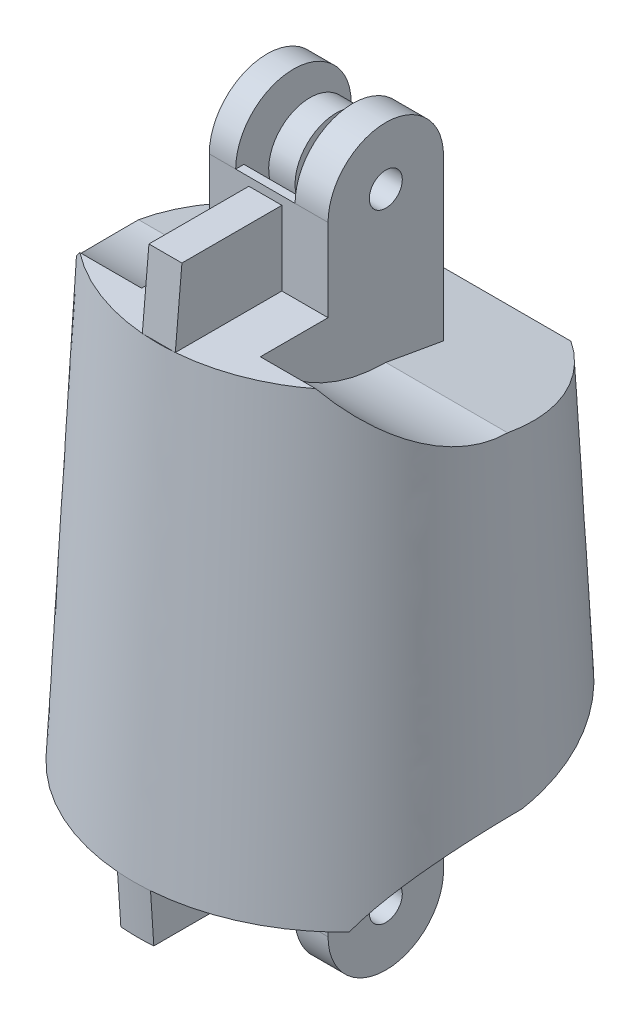
from build123d import *

# Parameters (mm, degrees)
SKETCH1_RX                      = 11
SKETCH1_RY                      = 10
SKETCH2_RX                      = 12.25
SKETCH2_RY                      = 11.5
HINGE_START                     = 1.8
SKETCH6_R                       = 1
HINGE_RIGHT_DEPTH               = 2
SPRING_SEAT_REACH               = 34.227
SPRING_SEAT_DIRECTION_2_REACH   = 34.227
ROUNDED_START                   = 3.8
SKETCH8_R                       = 9.1
ROUNDED_CUT_1_DEPTH             = 29.426735954
ROUNDED_START_2                 = -3.4
SKETCH8_2_R                     = 9.1
ROUNDED_CUT_2_DEPTH             = 29.826735954
BETWEEN_ROUNDED_CUTS_DEPTH      = 33.226735954
SKETCH13_R                      = 2.5
SPRING_DEPTH                    = 0.8
BOTTOM_START                    = -12.115064089
BOTTOM_HINGE_MIRROR_DEPTH       = 24.365064089
BOTTOM_START_2                  = -13
BOTTOM_HINGE_MIRROR_2_DEPTH     = 9.6
BOTTOM_START_3                  = 3.8
BOTTOM_HINGE_MIRROR_3_DEPTH     = 9.2
BOTTOM_START_4                  = -3.4
BOTTOM_HINGE_MIRROR_4_DEPTH     = 7.2
BOTTOM_START_5                  = 1.8
BOTTOM_HINGE_MIRROR_5_OUTLINE_R = 1
BOTTOM_HINGE_MIRROR_5_DEPTH     = 2
BOTTOM_HINGE_MIRROR_6_OUTLINE_R = 1
BOTTOM_HINGE_MIRROR_6_DEPTH     = 1.6
CUT_EXTRUDE1_DEPTH              = 40.670912859
CUT_EXTRUDE1_DEPTH_BACK         = 40.670912859
SKETCH11_W                      = 16.412618891
SKETCH11_H                      = 3
SKETCH12_R                      = 1.1
CORD_HOLE_DEPTH                 = 40.670912859
SPRING_SLOT_1_DEPTH             = 11
SPRING_SLOT_2_2_DEPTH           = 11
BOSS_EXTRUDE1_DEPTH             = 4.5
CUT_EXTRUDE2_DEPTH              = 40.986355172
CUT_EXTRUDE2_DEPTH_BACK         = 40.986355172
BOSS_EXTRUDE2_DEPTH             = 3
CHAMFER1_SIZE                   = 0.2
SKETCH19_W                      = 2
SKETCH19_H                      = 4.5
BOSS_EXTRUDE3_DEPTH             = 1.458591955
BOSS_EXTRUDE4_REACH             = 42.173
SKETCH20_W                      = 2
SKETCH20_H                      = 3


with BuildPart() as part:
    # Sketch1 → Loft2 section 0
    with BuildSketch(Plane(origin=(0, 0, 0), x_dir=(1, 0, 0), z_dir=(0, 1, 0))):
        with Locations(Location((0, 0), (0, 0, 0))):
            Ellipse(SKETCH1_RX, SKETCH1_RY)
    # Sketch2 → Loft2 section 1
    with BuildSketch(Plane(origin=(0, -27.5, 0), x_dir=(1, 0, 0), z_dir=(0, 1, 0))):
        with Locations((0, 0)):
            Ellipse(SKETCH2_RX, SKETCH2_RY)
    loft()

    # Sketch6 → hinge right (add)
    with BuildSketch(Plane(origin=(0, 0, 0), x_dir=(0, 0, -1), z_dir=(1, 0, 0)).offset(HINGE_START)):
        with BuildLine():
            Line((-3.5, 0), (-3.5, 5))
            ThreePointArc((-3.5, 5), (0, 8.5), (3.5, 5))
            Line((3.5, 5), (3.5, 0))
            Line((3.5, 0), (-3.5, 0))
        make_face()
        with Locations((0, 5)):
            Circle(SKETCH6_R, mode=Mode.SUBTRACT)
    hinge_right = extrude(amount=HINGE_RIGHT_DEPTH)

    # hinge left: hinge right across plane
    add(hinge_right.mirror(Plane(origin=(0, 0, 0), x_dir=(0, 0, 1), z_dir=(1, 0, 0))))

    # Sketch7 → spring seat (add, up to next)
    with BuildSketch(Plane(origin=(0, 0, 0), x_dir=(0, 0, -1), z_dir=(1, 0, 0)), mode=Mode.PRIVATE) as spring_seat_sk1:
        with BuildLine():
            Line((3, 5), (3.5, 5))
            Line((3.5, 5), (3.5, 0))
            Line((3.5, 0), (-3.5, 0))
            Line((-3.5, 0), (-3.5, 5))
            Line((-3.5, 5), (-3, 5))
            ThreePointArc((-3, 5), (0, 2), (3, 5))
        make_face()
    spring_seat_tool1 = extrude(spring_seat_sk1.sketch, amount=SPRING_SEAT_REACH, mode=Mode.PRIVATE) - part.part
    add(spring_seat_tool1.solids().sort_by_distance((0, 1.668717, 0))[0])

    # Sketch7 → spring seat direction 2 (add, up to next)
    with BuildSketch(Plane(origin=(0, 0, 0), x_dir=(0, 0, -1), z_dir=(1, 0, 0)), mode=Mode.PRIVATE) as spring_seat_direction_2_sk1:
        with BuildLine():
            Line((3, 5), (3.5, 5))
            Line((3.5, 5), (3.5, 0))
            Line((3.5, 0), (-3.5, 0))
            Line((-3.5, 0), (-3.5, 5))
            Line((-3.5, 5), (-3, 5))
            ThreePointArc((-3, 5), (0, 2), (3, 5))
        make_face()
    spring_seat_direction_2_tool1 = extrude(spring_seat_direction_2_sk1.sketch, amount=-SPRING_SEAT_DIRECTION_2_REACH, mode=Mode.PRIVATE) - part.part
    add(spring_seat_direction_2_tool1.solids().sort_by_distance((0, 1.668717, 0))[0])

    # Sketch8 → rounded cut 1 (cut, through all)
    with BuildSketch(Plane(origin=(0, 0, 0), x_dir=(0, 0, -1), z_dir=(1, 0, 0)).offset(ROUNDED_START)):
        with BuildLine():
            ThreePointArc((9.1, 5), (6.434671709, -1.434671709), (0, -4.1))
            Line((0, -4.1), (12.1, -6.233556467))
            Line((12.1, -6.233556467), (12.1, 5))
            Line((12.1, 5), (9.1, 5))
        make_face()
        with Locations((0, 5)):
            Circle(SKETCH8_R)
    extrude(amount=ROUNDED_CUT_1_DEPTH, mode=Mode.SUBTRACT)

    # Sketch8<2> → rounded cut 2 (cut, through all)
    with BuildSketch(Plane(origin=(0, 0, 0), x_dir=(0, 0, -1), z_dir=(1, 0, 0)).offset(ROUNDED_START_2)):
        with BuildLine():
            ThreePointArc((9.1, 5), (6.434671709, -1.434671709), (0, -4.1))
            Line((0, -4.1), (12.1, -6.233556467))
            Line((12.1, -6.233556467), (12.1, 5))
            Line((12.1, 5), (9.1, 5))
        make_face()
        with Locations((0, 5)):
            Circle(SKETCH8_2_R)
    extrude(amount=-ROUNDED_CUT_2_DEPTH, mode=Mode.SUBTRACT)

    # Sketch9 → between rounded cuts (cut, symmetric)
    with BuildSketch(Plane(origin=(0, 0, 0), x_dir=(0, 0, -1), z_dir=(1, 0, 0))):
        Polygon((3.5, 0), (3.5, -4.717144432), (12.5, -6.304087259), (12.5, 0), align=None)
    extrude(amount=BETWEEN_ROUNDED_CUTS_DEPTH, both=True, mode=Mode.SUBTRACT)

    # bottom hinge mirror: read off the stored shape, not the designer's step
    # bottom hinge mirror outline → bottom hinge mirror (cut)
    with BuildSketch(Plane.YZ.offset(BOTTOM_START)):
        Polygon((-22.782855568, -3.5), (-27.5, -3.5), (-27.5, -13), (-21.107749251, -13), (-21.430613989, -11.16894308), align=None)
    extrude(amount=BOTTOM_HINGE_MIRROR_DEPTH, mode=Mode.SUBTRACT)

    # bottom hinge mirror 2 outline → bottom hinge mirror 2 (cut)
    with BuildSketch(Plane.YZ.offset(BOTTOM_START_2)):
        with BuildLine():
            Line((-27.5, -3.5), (-22.782855568, -3.5))
            Line((-22.782855568, -3.5), (-23.4, 0))
            ThreePointArc((-23.4, 0), (-24.490318358, 4.319143434), (-27.5, 7.603288762))
            Line((-27.5, 7.603288762), (-27.5, -3.5))
        make_face()
    extrude(amount=BOTTOM_HINGE_MIRROR_2_DEPTH, mode=Mode.SUBTRACT)

    # bottom hinge mirror 3 outline → bottom hinge mirror 3 (cut)
    with BuildSketch(Plane.YZ.offset(BOTTOM_START_3)):
        with BuildLine():
            Line((-27.5, -3.5), (-22.782855568, -3.5))
            Line((-22.782855568, -3.5), (-23.4, 0))
            ThreePointArc((-23.4, 0), (-24.490318358, 4.319143434), (-27.5, 7.603288762))
            Line((-27.5, 7.603288762), (-27.5, -3.5))
        make_face()
    extrude(amount=BOTTOM_HINGE_MIRROR_3_DEPTH, mode=Mode.SUBTRACT)

    # bottom hinge mirror 4 outline → bottom hinge mirror 4 (add)
    with BuildSketch(Plane.YZ.offset(BOTTOM_START_4)):
        with BuildLine():
            Line((-32.5, -3), (-32.5, -3.5))
            Line((-32.5, -3.5), (-27.5, -3.5))
            Line((-27.5, -3.5), (-27.5, 3.5))
            Line((-27.5, 3.5), (-32.5, 3.5))
            Line((-32.5, 3.5), (-32.5, 3))
            ThreePointArc((-32.5, 3), (-29.5, 0), (-32.5, -3))
        make_face()
    extrude(amount=BOTTOM_HINGE_MIRROR_4_DEPTH)

    # bottom hinge mirror 5 outline → bottom hinge mirror 5 (add)
    with BuildSketch(Plane.YZ.offset(BOTTOM_START_5)):
        with BuildLine():
            ThreePointArc((-32.5, 3.5), (-36, 0), (-32.5, -3.5))
            Line((-32.5, -3.5), (-32.5, -3))
            ThreePointArc((-32.5, -3), (-29.5, 0), (-32.5, 3))
            Line((-32.5, 3), (-32.5, 3.5))
        make_face()
        with Locations((-32.5, 0)):
            Circle(BOTTOM_HINGE_MIRROR_5_OUTLINE_R, mode=Mode.SUBTRACT)
    extrude(amount=BOTTOM_HINGE_MIRROR_5_DEPTH)

    # bottom hinge mirror 6 outline → bottom hinge mirror 6 (add)
    with BuildSketch(Plane.YZ.offset(BOTTOM_START_4)):
        with BuildLine():
            ThreePointArc((-32.5, 3.5), (-36, 0), (-32.5, -3.5))
            Line((-32.5, -3.5), (-32.5, -3))
            ThreePointArc((-32.5, -3), (-29.5, 0), (-32.5, 3))
            Line((-32.5, 3), (-32.5, 3.5))
        make_face()
        with Locations((-32.5, 0)):
            Circle(BOTTOM_HINGE_MIRROR_6_OUTLINE_R, mode=Mode.SUBTRACT)
    extrude(amount=BOTTOM_HINGE_MIRROR_6_DEPTH)

    # Sketch11 → Cut-Extrude1 (cut, two sides: drawn at the far end of the back side and taken through both)
    with BuildSketch(Plane(origin=(0, 0, 0), x_dir=(1, 0, 0), z_dir=(0, 1, 0)).offset(-CUT_EXTRUDE1_DEPTH_BACK)):
        with Locations((-3.7748e-05, 9.668942571)):
            Rectangle(SKETCH11_W, SKETCH11_H)
    extrude(amount=CUT_EXTRUDE1_DEPTH + CUT_EXTRUDE1_DEPTH_BACK, mode=Mode.SUBTRACT)

    # Sketch12 → cord hole (cut, through all)
    with BuildSketch(Plane.XZ.offset(27.5)):
        with Locations(Location((0, -4.6, 0), (0, 0, 90))):
            Circle(SKETCH12_R)
    extrude(amount=-CORD_HOLE_DEPTH, mode=Mode.SUBTRACT)


with BuildPart() as body_2:
    # Sketch13 → spring (new, symmetric)
    with BuildSketch(Plane(origin=(0, 0, 0), x_dir=(0, 0, -1), z_dir=(1, 0, 0))):
        with Locations((0, 5)):
            Circle(SKETCH13_R)
    extrude(amount=SPRING_DEPTH, both=True)


with BuildPart() as spring_slot_1_tool:
    # Sketch14 → spring slot 1 (new body)
    with BuildSketch(Plane(origin=(0, 4.106969024, 1.915111108), x_dir=(-1, 0, 0), z_dir=(0, 0.9063077870366496, 0.4226182617407003))):
        with BuildLine():
            Line((-0.8, 0.886908691), (0.8, 0.886908691))
            ThreePointArc((0.8, 0.886908691), (1.3, 0.386908691), (0.8, -0.113091309))
            Line((0.8, -0.113091309), (-0.8, -0.113091309))
            ThreePointArc((-0.8, -0.113091309), (-1.3, 0.386908691), (-0.8, 0.886908691))
        make_face()
    extrude(amount=-SPRING_SLOT_1_DEPTH)


with BuildPart() as part_1:
    add(part.part)

    # spring slot 1: cut by spring_slot_1_tool
    add(spring_slot_1_tool.part, mode=Mode.SUBTRACT)

    # Sketch15 → spring slot 2.2 (cut)
    with BuildSketch(Plane(origin=(0, -26.695298657, 12.448222201), x_dir=(-1, 0, 0), z_dir=(0, -0.9063077870366496, 0.4226182617407003))):
        with BuildLine():
            Line((-0.8, 11.735093507), (0.8, 11.735093507))
            ThreePointArc((0.8, 11.735093507), (1.3, 11.235093507), (0.8, 10.735093507))
            Line((0.8, 10.735093507), (-0.8, 10.735093507))
            ThreePointArc((-0.8, 10.735093507), (-1.3, 11.235093507), (-0.8, 11.735093507))
        make_face()
    extrude(amount=-SPRING_SLOT_2_2_DEPTH, mode=Mode.SUBTRACT)

    # Sketch16 → Boss-Extrude1 (add)
    with BuildSketch(Plane(origin=(0, 0, 0), x_dir=(1, 0, 0), z_dir=(0, 1, 0))):
        with BuildLine():
            Line((-1, -9.958591955), (-1, -4.958591955))
            Line((-1, -4.958591955), (1, -4.958591955))
            Line((1, -4.958591955), (1, -9.958591955))
            add(Edge.make_bspline(
                [(-1, -9.958591955), (0, -10.041580221), (1, -9.958591955)],
                knots=[4.621354202, 4.621354202, 4.621354202, 4.803423758, 4.803423758, 4.803423758], degree=2, weights=[1, 0.995859195, 1]))
        make_face()
    extrude(amount=BOSS_EXTRUDE1_DEPTH)

    # Sketch18 → Cut-Extrude2 (cut, two sides: drawn at the far end of the back side and taken through both)
    with BuildSketch(Plane(origin=(1, 0, 0), x_dir=(0, 0, -1), z_dir=(1, 0, 0)).offset(-CUT_EXTRUDE2_DEPTH_BACK)):
        Polygon((-9.958591955, 0), (-9.558591955, 4.5), (-10.373375504, 4.5), (-10.015577865, 0), align=None)
    extrude(amount=CUT_EXTRUDE2_DEPTH + CUT_EXTRUDE2_DEPTH_BACK, mode=Mode.SUBTRACT)

    # Sketch17 → Boss-Extrude2 (add)
    with BuildSketch(Plane.XZ.offset(27.5)):
        with BuildLine():
            Line((-1, 11.461618583), (-1, 4.958591955))
            Line((-1, 4.958591955), (1, 4.958591955))
            Line((1, 4.958591955), (1, 11.461618583))
            add(Edge.make_bspline(
                [(1, 11.461618583), (0, 11.538509945), (-1, 11.461618583)],
                knots=[1.489072736, 1.489072736, 1.489072736, 1.652519918, 1.652519918, 1.652519918], degree=2, weights=[1, 0.996662485, 1]))
        make_face()
    extrude(amount=BOSS_EXTRUDE2_DEPTH)

    # Chamfer1
    # the kernel refuses this chamfer: 3, 0.2 mm, written as the material it takes off along each edge
    with BuildSketch(Plane(origin=(0, -30.5, -1.546040661), x_dir=(0.6245539436909985, 0, 0.78098167162874), z_dir=(0.78098167162874, 0, -0.6245539436909985))) as chamfer1_piece_1:
        Polygon((13.046040661, -2.999987307), (13.046041508 - CHAMFER1_SIZE, 0), (13.046041508, 0), align=None)
    revolve(axis=Axis((0, -30.5, -1.546040661), (0, -1, 0)), revolution_arc=77.298911182, mode=Mode.SUBTRACT)

    # Sketch19 → Boss-Extrude3 (add)
    with BuildSketch(Plane(origin=(0, 0, 4.958591955), x_dir=(-1, 0, 0), z_dir=(0, 0, -1))):
        with Locations((0, 2.25)):
            Rectangle(SKETCH19_W, SKETCH19_H)
    extrude(amount=BOSS_EXTRUDE3_DEPTH)

    # Sketch20 → Boss-Extrude4 (add, up to next)
    with BuildSketch(Plane(origin=(0, 0, 4.958591955), x_dir=(-1, 0, 0), z_dir=(0, 0, -1)), mode=Mode.PRIVATE) as boss_extrude4_sk1:
        with Locations((0, -29)):
            Rectangle(SKETCH20_W, SKETCH20_H)
    boss_extrude4_tool1 = extrude(boss_extrude4_sk1.sketch, amount=BOSS_EXTRUDE4_REACH, mode=Mode.PRIVATE) - part_1.part
    add(boss_extrude4_tool1.solids().sort_by_distance((0, -29, 4.958592))[0])


with BuildPart() as body_2_1:
    add(body_2.part)

    # spring slot 1: cut by spring_slot_1_tool
    add(spring_slot_1_tool.part, mode=Mode.SUBTRACT)


with BuildPart() as body_3:
    # Mirror2: mirrored copy
    add(body_2_1.part.mirror(Plane.ZX.offset(-13.75)))


solid = Compound([part_1.part, body_2_1.part, body_3.part])
